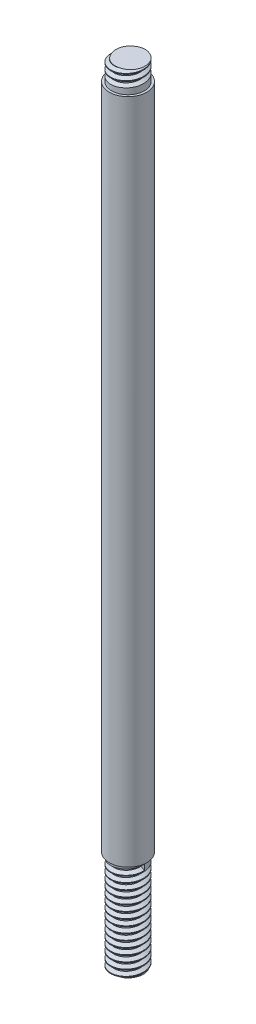
from build123d import *

# Parameters (mm, degrees)
SKETCH1_R           = 2.38125
BOSS_EXTRUDE1_DEPTH = 100
SKETCH2_R           = 2.38125
SKETCH2_R_2         = 2.0828
CUT_EXTRUDE1_DEPTH  = 12.7
THREAD1_PITCH       = 0.79375
CUT_EXTRUDE2_START  = -2.54
SKETCH3_R           = 2.38125
SKETCH3_R_2         = 2.085588765
CUT_EXTRUDE2_DEPTH  = 2.54
THREAD2_PITCH       = 0.79375


with BuildPart() as part:
    # Sketch1 → Boss-Extrude1 (new body)
    with BuildSketch(Plane(origin=(0, 0, 0), x_dir=(1, 0, 0), z_dir=(0, 1, 0))):
        with Locations(Location((0, 0, 0), (0, 0, 270))):
            Circle(SKETCH1_R)
    extrude(amount=BOSS_EXTRUDE1_DEPTH)

    # Sketch2 → Cut-Extrude1 (cut)
    with BuildSketch(Plane.XZ):
        with Locations(Location((0, 0, 0), (0, 0, 270))):
            Circle(SKETCH2_R)
        with Locations(Location((0, 0, 0), (0, 0, 270))):
            Circle(SKETCH2_R_2, mode=Mode.SUBTRACT)
    extrude(amount=-CUT_EXTRUDE1_DEPTH, mode=Mode.SUBTRACT)

    # Thread1: the profile of Thread Profile1 profile screwed along a right-hand helix of 16 turns, 8 arcs to a turn; built about Z, then put on its axis
    thread1_z = Axis((0, 0, 0), (0, 0, 1))
    thread1_corners = [(2.0831, 0, -0.000173205), (2.0831, 0, 0.694704453), (1.653170212, 0, 0.446484374), (1.653170212, 0, 0.248046874)]
    with BuildLine(mode=Mode.PRIVATE) as thread1_profile:
        Line(thread1_corners[0], thread1_corners[1])
        Line(thread1_corners[1], thread1_corners[2])
        Line(thread1_corners[2], thread1_corners[3])
        Line(thread1_corners[3], thread1_corners[0])
    thread1_cap = Face(thread1_profile.wire())
    thread1_turn_angles = [0, 22.5, 45, 67.5, 90, 112.5, 135, 157.5, 180, 202.5, 225, 247.5, 270, 292.5, 315, 337.5, 360]
    thread1_turn_weights = [1, 0.9238795325112867, 1, 0.9238795325112867, 1, 0.9238795325112867, 1, 0.9238795325112867, 1, 0.9238795325112867, 1, 0.9238795325112867, 1, 0.9238795325112867, 1, 0.9238795325112867, 1]
    thread1_turn_rails = [Edge.make_bspline([Vector(p[0], p[1], 0).rotate(thread1_z, thread1_turn_angles[k]) / thread1_turn_weights[k] + Vector(0, 0, p[2] + THREAD1_PITCH * thread1_turn_angles[k] / 360) for k in range(17)], [0, 0, 0, 1, 1, 2, 2, 3, 3, 4, 4, 5, 5, 6, 6, 7, 7, 8, 8, 8], 2, thread1_turn_weights) for p in thread1_corners]
    thread1_turn_sides = [Face.make_surface_from_curves(thread1_turn_rails[p[0]], thread1_turn_rails[p[1]]) for p in [(0, 1), (1, 2), (2, 3), (3, 0)]]
    thread1 = Plane(origin=(0, -1, 0), x_dir=(1, 0, 0), z_dir=(0, 1, 0)) * Solid(Shell([*[p.moved(Location((0, 0, THREAD1_PITCH * i))) for i in range(16) for p in thread1_turn_sides], thread1_cap, thread1_cap.rotate(thread1_z, 5760).moved(Location((0, 0, THREAD1_PITCH * 5760 / 360)))]))
    add(thread1, mode=Mode.SUBTRACT)

    # Sketch3 → Cut-Extrude2 (cut)
    with BuildSketch(Plane(origin=(0, 100, 0), x_dir=(1, 0, 0), z_dir=(0, 1, 0)).offset(CUT_EXTRUDE2_START)):
        with Locations(Location((0, 0, 0), (0, 0, 90))):
            Circle(SKETCH3_R)
        with Locations(Location((0, 0, 0), (0, 0, 270))):
            Circle(SKETCH3_R_2, mode=Mode.SUBTRACT)
    extrude(amount=CUT_EXTRUDE2_DEPTH, mode=Mode.SUBTRACT)

    # Thread2: the profile of Thread Profile2 profile screwed along a right-hand helix of 3.2 turns, 8 arcs to a turn; built about Z, then put on its axis
    thread2_z = Axis((0, 0, 0), (0, 0, 1))
    thread2_corners = [(2.085888765, 0, -0.000173205), (2.085888765, 0, 0.694704453), (1.655958977, 0, 0.446484374), (1.655958977, 0, 0.248046874)]
    with BuildLine(mode=Mode.PRIVATE) as thread2_profile:
        Line(thread2_corners[0], thread2_corners[1])
        Line(thread2_corners[1], thread2_corners[2])
        Line(thread2_corners[2], thread2_corners[3])
        Line(thread2_corners[3], thread2_corners[0])
    thread2_cap = Face(thread2_profile.wire())
    thread2_turn_angles = [0, 22.5, 45, 67.5, 90, 112.5, 135, 157.5, 180, 202.5, 225, 247.5, 270, 292.5, 315, 337.5, 360]
    thread2_turn_weights = [1, 0.9238795325112867, 1, 0.9238795325112867, 1, 0.9238795325112867, 1, 0.9238795325112867, 1, 0.9238795325112867, 1, 0.9238795325112867, 1, 0.9238795325112867, 1, 0.9238795325112867, 1]
    thread2_turn_rails = [Edge.make_bspline([Vector(p[0], p[1], 0).rotate(thread2_z, thread2_turn_angles[k]) / thread2_turn_weights[k] + Vector(0, 0, p[2] + THREAD2_PITCH * thread2_turn_angles[k] / 360) for k in range(17)], [0, 0, 0, 1, 1, 2, 2, 3, 3, 4, 4, 5, 5, 6, 6, 7, 7, 8, 8, 8], 2, thread2_turn_weights) for p in thread2_corners]
    thread2_turn_sides = [Face.make_surface_from_curves(thread2_turn_rails[p[0]], thread2_turn_rails[p[1]]) for p in [(0, 1), (1, 2), (2, 3), (3, 0)]]
    thread2_last_angles = [1080, 1102.5, 1125, 1138.5, 1152]
    thread2_last_weights = [1, 0.9238795325112867, 1, 0.9723699203976766, 1]
    thread2_last_rails = [Edge.make_bspline([Vector(p[0], p[1], 0).rotate(thread2_z, thread2_last_angles[k]) / thread2_last_weights[k] + Vector(0, 0, p[2] + THREAD2_PITCH * thread2_last_angles[k] / 360) for k in range(5)], [0, 0, 0, 1, 1, 2, 2, 2], 2, thread2_last_weights) for p in thread2_corners]
    thread2_last_sides = [Face.make_surface_from_curves(thread2_last_rails[p[0]], thread2_last_rails[p[1]]) for p in [(0, 1), (1, 2), (2, 3), (3, 0)]]
    thread2 = Plane(origin=(0, 101, 0), x_dir=(-1, 0, 0), z_dir=(0, -1, 0)) * Solid(Shell([*[p.moved(Location((0, 0, THREAD2_PITCH * i))) for i in range(3) for p in thread2_turn_sides], *thread2_last_sides, thread2_cap, thread2_cap.rotate(thread2_z, 1152).moved(Location((0, 0, THREAD2_PITCH * 1152 / 360)))]))
    add(thread2, mode=Mode.SUBTRACT)


solid = part.part
